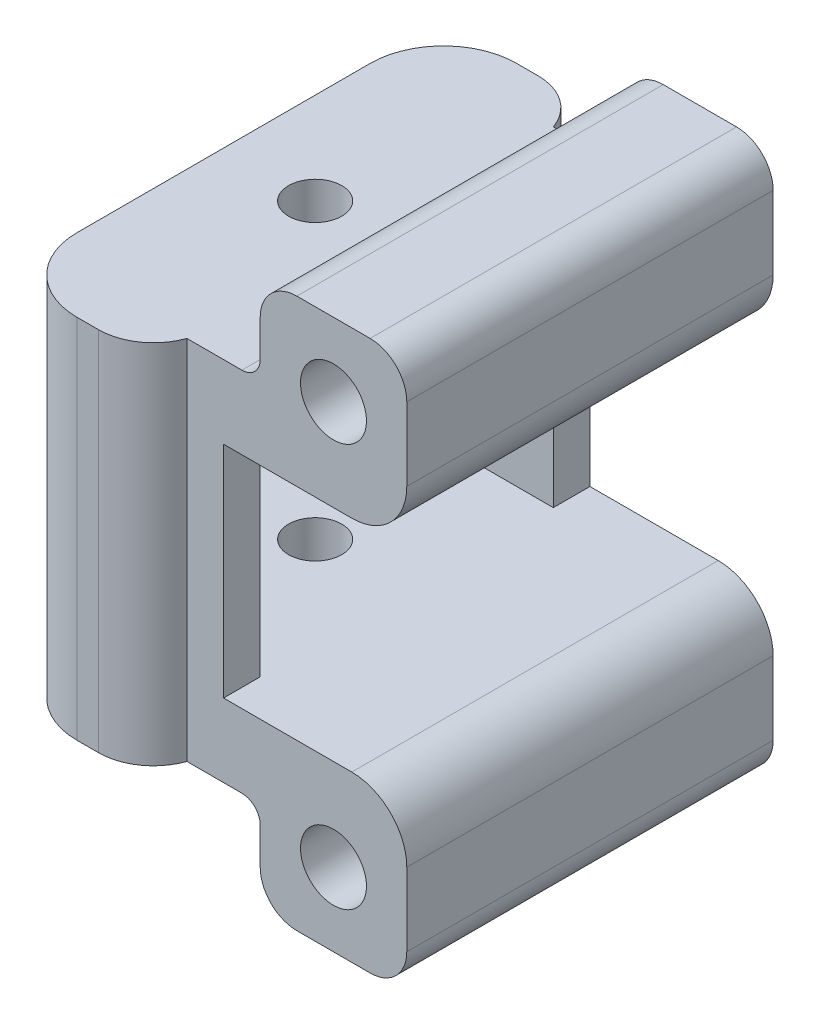
from build123d import *

# Parameters (mm, degrees)
SKETCH1_W           = 20
SKETCH1_H           = 20
BOSS_EXTRUDE1_DEPTH = 4
SKETCH2_R           = 3.7
CUT_EXTRUDE1_DEPTH  = 2.6
SKETCH3_R           = 2.1
CUT_EXTRUDE2_DEPTH  = 29.403520909
SKETCH4_W           = 12
SKETCH4_H           = 4
BOSS_EXTRUDE2_DEPTH = 12
SKETCH7_W           = 20
SKETCH7_H           = 4
BOSS_EXTRUDE3_DEPTH = 10
SKETCH8_W           = 8
SKETCH8_H           = 20
BOSS_EXTRUDE4_DEPTH = 5
SKETCH9_W           = 8
SKETCH9_H           = 20
BOSS_EXTRUDE5_DEPTH = 5
SKETCH10_R          = 1.8
CUT_EXTRUDE5_DEPTH  = 42.243181255
SKETCH11_W          = 30
SKETCH11_H          = 30
CUT_EXTRUDE6_DEPTH  = 6
SKETCH12_R          = 1.45
CUT_EXTRUDE7_DEPTH  = 42.243181255
SKETCH13_W          = 8
SKETCH13_H          = 20
BOSS_EXTRUDE6_DEPTH = 2
SKETCH14_W          = 8
SKETCH14_H          = 20
BOSS_EXTRUDE7_DEPTH = 2
SKETCH15_W          = 16
SKETCH15_H          = 12
CUT_EXTRUDE8_DEPTH  = 39.845849199
FILLET2_R           = 3
FILLET4_R           = 2
FILLET5_START       = -21
FILLET5_DEPTH       = 22
FILLET6_R           = 3
FILLET7_R           = 1
FILLET8_R           = 1


with BuildPart() as part:
    # Sketch1 → Boss-Extrude1 (new body)
    with BuildSketch(Plane(origin=(0, 0, 0), x_dir=(0, 0, -1), z_dir=(1, 0, 0))):
        with Locations((-10, -10)):
            Rectangle(SKETCH1_W, SKETCH1_H)
    extrude(amount=BOSS_EXTRUDE1_DEPTH)

    # Sketch2 → Cut-Extrude1 (cut)
    with BuildSketch(Plane(origin=(4, 0, 0), x_dir=(0, 0, -1), z_dir=(1, 0, 0))):
        with Locations((-10, -10)):
            Circle(SKETCH2_R)
    extrude(amount=-CUT_EXTRUDE1_DEPTH, mode=Mode.SUBTRACT)

    # Sketch3 → Cut-Extrude2 (cut, through all)
    with BuildSketch(Plane(origin=(1.4, 0, 0), x_dir=(0, 0, -1), z_dir=(1, 0, 0))):
        with Locations((-10, -10)):
            Circle(SKETCH3_R)
    extrude(amount=-CUT_EXTRUDE2_DEPTH, mode=Mode.SUBTRACT)

    # Sketch4 → Boss-Extrude2 (add)
    with BuildSketch(Plane(origin=(4, 0, 0), x_dir=(0, 0, -1), z_dir=(1, 0, 0))):
        Polygon((-20, 0), (-20, -20), (-16, -20), (-16, -16), (-16, -4), (-16, 0), align=None)
        with Locations((-10, -18)):
            Rectangle(SKETCH4_W, SKETCH4_H)
        Polygon((-4, -16), (-4, -20), (0, -20), (0, -4), (-4, -4), align=None)
        Polygon((0, 0), (-16, 0), (-16, -4), (-4, -4), (0, -4), align=None)
    extrude(amount=BOSS_EXTRUDE2_DEPTH)

    # Sketch7 → Boss-Extrude3 (add)
    with BuildSketch(Plane(origin=(16, 0, 0), x_dir=(0, 0, -1), z_dir=(1, 0, 0))):
        with Locations((-10, -18)):
            Rectangle(SKETCH7_W, SKETCH7_H)
        with Locations((-10, -2)):
            Rectangle(SKETCH7_W, SKETCH7_H)
    extrude(amount=BOSS_EXTRUDE3_DEPTH)

    # Sketch8 → Boss-Extrude4 (add)
    with BuildSketch(Plane(origin=(0, -20, 0), x_dir=(-1, 0, 0), z_dir=(0, -1, 0))):
        with Locations((-22, -10)):
            Rectangle(SKETCH8_W, SKETCH8_H)
    extrude(amount=BOSS_EXTRUDE4_DEPTH)

    # Sketch9 → Boss-Extrude5 (add)
    with BuildSketch(Plane(origin=(0, 0, 0), x_dir=(1, 0, 0), z_dir=(0, 1, 0))):
        with Locations((22, -10)):
            Rectangle(SKETCH9_W, SKETCH9_H)
    extrude(amount=BOSS_EXTRUDE5_DEPTH)

    # Sketch10 → Cut-Extrude5 (cut, through all)
    with BuildSketch(Plane(origin=(0, 0, 0), x_dir=(-1, 0, 0), z_dir=(0, 0, -1))):
        with Locations(Location((-22, 1, 0), (0, 0, 90))):
            Circle(SKETCH10_R)
        with Locations(Location((-22, -21, 0), (0, 0, 90))):
            Circle(SKETCH10_R)
    extrude(amount=-CUT_EXTRUDE5_DEPTH, mode=Mode.SUBTRACT)

    # Sketch11 → Cut-Extrude6 (cut)
    with BuildSketch(Plane.ZY):
        with Locations((15, -5)):
            Rectangle(SKETCH11_W, SKETCH11_H)
    extrude(amount=-CUT_EXTRUDE6_DEPTH, mode=Mode.SUBTRACT)

    # Sketch12 → Cut-Extrude7 (cut, through all)
    with BuildSketch(Plane(origin=(0, 0, 0), x_dir=(1, 0, 0), z_dir=(0, 1, 0))):
        with Locations(Location((11, -10, 0), (0, 0, 270))):
            Circle(SKETCH12_R)
    extrude(amount=-CUT_EXTRUDE7_DEPTH, mode=Mode.SUBTRACT)

    # Sketch13 → Boss-Extrude6 (add)
    with BuildSketch(Plane.XY.offset(20)):
        with Locations((10, -10)):
            Rectangle(SKETCH13_W, SKETCH13_H)
    extrude(amount=BOSS_EXTRUDE6_DEPTH)

    # Sketch14 → Boss-Extrude7 (add)
    with BuildSketch(Plane(origin=(0, 0, 0), x_dir=(-1, 0, 0), z_dir=(0, 0, -1))):
        with Locations((-10, -10)):
            Rectangle(SKETCH14_W, SKETCH14_H)
    extrude(amount=BOSS_EXTRUDE7_DEPTH)

    # Sketch15 → Cut-Extrude8 (cut, through all)
    with BuildSketch(Plane.ZY.offset(-6)):
        with Locations((10, -10)):
            Rectangle(SKETCH15_W, SKETCH15_H)
    extrude(amount=-CUT_EXTRUDE8_DEPTH, mode=Mode.SUBTRACT)

    # Fillet2
    fillet2_edges = [part.edges().sort_by_distance(p)[0] for p in [
        (26, -16, 10),
        (26, -4, 10),
    ]]
    fillet(fillet2_edges, radius=FILLET2_R)

    # Fillet4
    fillet4_edges = [part.edges().sort_by_distance(p)[0] for p in [
        (26, -25, 10),
        (18, -25, 10),
        (26, 5, 10),
        (18, 5, 10),
    ]]
    fillet(fillet4_edges, radius=FILLET4_R)

    # Fillet5: read off the stored shape, not the designer's step
    # Fillet5 outline → Fillet5 (cut)
    with BuildSketch(Plane(origin=(0, 0, 0), x_dir=(1, 0, 0), z_dir=(0, 1, 0)).offset(FILLET5_START)):
        with BuildLine():
            Line((6, 2), (6, -2))
            ThreePointArc((6, -2), (7.171572875, 0.828427125), (10, 2))
            Line((10, 2), (6, 2))
        make_face()
        with BuildLine():
            ThreePointArc((10, -22), (7.171572875, -20.828427125), (6, -18))
            Line((6, -18), (6, -22))
            Line((6, -22), (10, -22))
        make_face()
    extrude(amount=FILLET5_DEPTH, mode=Mode.SUBTRACT)

    # Fillet6
    # the kernel refuses this fillet: 3 mm, written as the material it takes off along each edge
    with BuildSketch(Plane(origin=(14, -27.071067812, -2), x_dir=(-1, 0, 0), z_dir=(0, 1, 0))) as fillet6_piece_1:
        with BuildLine():
            CenterArc((2.828427125, 3), FILLET6_R, 199.471220634, 70.528779366)
            Line((0, 2), (-0.056568542, 1.98))
            ThreePointArc((-0.056568542, 1.98), (-0.06, 1), (-0.06, 0))
            Line((-0.06, 0), (0, -0.06))
            Line((0, -0.06), (2.828427125, -0.06))
            Line((2.828427125, -0.06), (2.828427125, 0))
        make_face()
    extrude(amount=34.142135624, mode=Mode.SUBTRACT)
    with BuildSketch(Plane(origin=(14, -27.071067812, 22), x_dir=(0, 0, -1), z_dir=(0, 1, 0))) as fillet6_piece_2:
        with BuildLine():
            CenterArc((3, 2.828427125), FILLET6_R, 180, 70.528779366)
            Line((0, 2.828427125), (-0.06, 2.828427125))
            Line((-0.06, 2.828427125), (-0.06, 0))
            Line((-0.06, 0), (0, -0.06))
            ThreePointArc((0, -0.06), (1, -0.06), (1.98, -0.056568542))
            Line((1.98, -0.056568542), (2, 0))
        make_face()
    extrude(amount=34.142135624, mode=Mode.SUBTRACT)

    # Fillet7
    fillet7_edges = [part.edges().sort_by_distance(p)[0] for p in [
        (18, -20, 10),
    ]]
    fillet(fillet7_edges, radius=FILLET7_R)

    # Fillet8
    fillet8_edges = [part.edges().sort_by_distance(p)[0] for p in [
        (18, 0, 10),
    ]]
    fillet(fillet8_edges, radius=FILLET8_R)


solid = part.part
